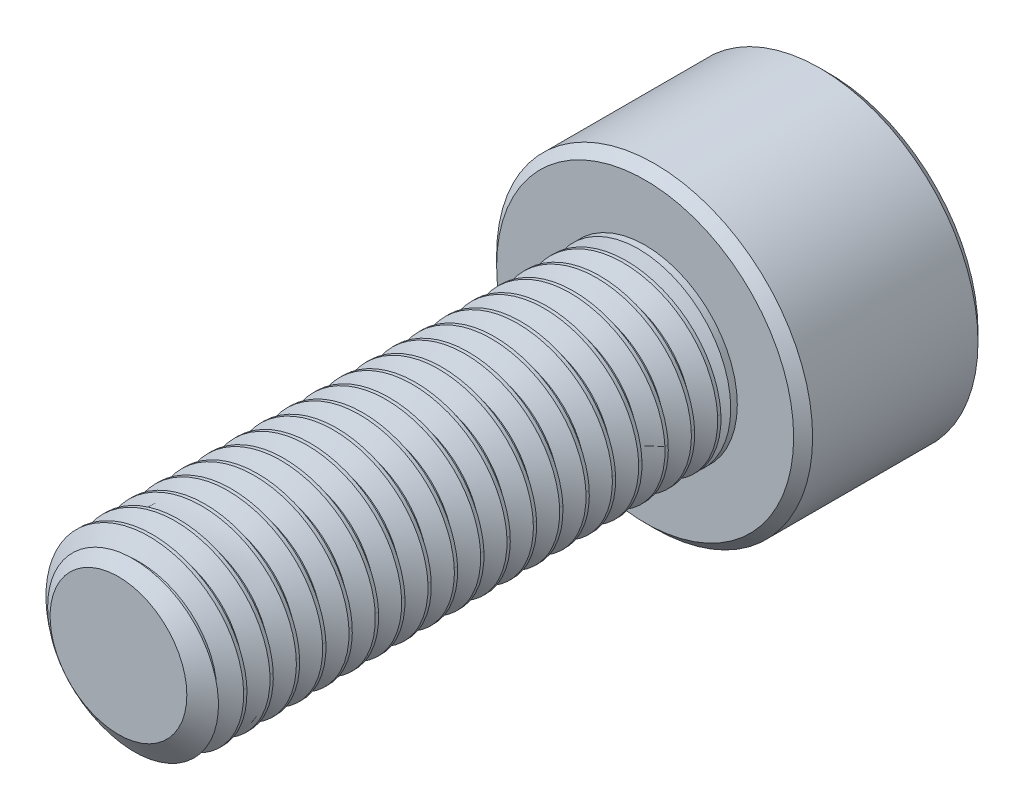
from build123d import *

# Parameters (mm, degrees)
SKETCH1_R          = 3.5
EXTRUDE1_DEPTH     = 20
CUT_SWEEP1_PITCH   = 1
SKETCH6_R          = 6
EXTRUDE2_DEPTH     = 7
CUT_EXTRUDE1_DEPTH = 4.5
CHAMFER1_SIZE      = 0.36


with BuildPart() as part:
    # Sketch1 → Extrude1 (new body)
    with BuildSketch(Plane.XY):
        Circle(SKETCH1_R)
    extrude(amount=-EXTRUDE1_DEPTH)

    # Cut-Sweep1: arcs per turn and ends read off the stored shape
    # Cut-Sweep1: the profile of Sketch3 profile screwed along a right-hand helix through 23 turns, 6 arcs to a turn; built about Z, then put on its axis
    cut_sweep1_z = Axis((0, 0, 0), (0, 0, 1))
    cut_sweep1_corners = [(3.5003, 0, -1.875173205), (2.850480947, 0, -1.5), (2.850480947, 0, -1.375), (3.5003, 0, -0.999826795)]
    with BuildLine(mode=Mode.PRIVATE) as cut_sweep1_profile:
        Line(cut_sweep1_corners[0], cut_sweep1_corners[1])
        Line(cut_sweep1_corners[1], cut_sweep1_corners[2])
        Line(cut_sweep1_corners[2], cut_sweep1_corners[3])
        Line(cut_sweep1_corners[3], cut_sweep1_corners[0])
    cut_sweep1_cap = Face(cut_sweep1_profile.wire())
    cut_sweep1_turn_angles = [0, 30, 60, 90, 120, 150, 180, 210, 240, 270, 300, 330, 360]
    cut_sweep1_turn_weights = [1, 0.8660254037844387, 1, 0.8660254037844387, 1, 0.8660254037844387, 1, 0.8660254037844387, 1, 0.8660254037844387, 1, 0.8660254037844387, 1]
    cut_sweep1_turn_rails = [Edge.make_bspline([Vector(p[0], p[1], 0).rotate(cut_sweep1_z, cut_sweep1_turn_angles[k]) / cut_sweep1_turn_weights[k] + Vector(0, 0, p[2] + CUT_SWEEP1_PITCH * cut_sweep1_turn_angles[k] / 360) for k in range(13)], [0, 0, 0, 1, 1, 2, 2, 3, 3, 4, 4, 5, 5, 6, 6, 6], 2, cut_sweep1_turn_weights) for p in cut_sweep1_corners]
    cut_sweep1_turn_sides = [Face.make_surface_from_curves(cut_sweep1_turn_rails[p[0]], cut_sweep1_turn_rails[p[1]]) for p in [(0, 1), (1, 2), (2, 3), (3, 0)]]
    cut_sweep1 = Plane(origin=(0, 0, 0), x_dir=(0, 1, 0), z_dir=(0, 0, -1)) * Solid(Shell([*[p.moved(Location((0, 0, CUT_SWEEP1_PITCH * i))) for i in range(23) for p in cut_sweep1_turn_sides], cut_sweep1_cap, cut_sweep1_cap.rotate(cut_sweep1_z, 8280).moved(Location((0, 0, CUT_SWEEP1_PITCH * 8280 / 360)))]))
    add(cut_sweep1, mode=Mode.SUBTRACT)

    # Sketch4 → Cut-Revolve1 (revolve, cut)
    with BuildSketch(Plane(origin=(0, 0, 0), x_dir=(0, 0, -1), z_dir=(1, 0, 0)), mode=Mode.PRIVATE) as cut_revolve1_sk:
        Polygon((0.632650852, 3.5), (0, 2.596480947), (0, 3.5), align=None)
    revolve(cut_revolve1_sk.sketch.rotate(Axis((0, 0, 0), (0, 0, -1)), 90), axis=Axis((0, 0, 0), (0, 0, -1)), mode=Mode.SUBTRACT)

    # Sketch6 → Extrude2 (add)
    with BuildSketch(Plane(origin=(0, 0, -20), x_dir=(-1, 0, 0), z_dir=(0, 0, -1))):
        with Locations(Location((0, 0, 0), (0, 0, 180))):
            Circle(SKETCH6_R)
    extrude(amount=EXTRUDE2_DEPTH)

    # Sketch7 → Cut-Extrude1 (cut)
    with BuildSketch(Plane(origin=(0, 0, -27), x_dir=(-1, 0, 0), z_dir=(0, 0, -1))):
        Polygon((0, 3.464101615), (-3, 1.732050808), (-3, -1.732050808), (0, -3.464101615), (3, -1.732050808), (3, 1.732050808), align=None)
    extrude(amount=-CUT_EXTRUDE1_DEPTH, mode=Mode.SUBTRACT)

    # Cut-Extrude2 cone 1 section (through the dimple's axis) → Cut-Extrude2 (revolve, cut)
    with BuildSketch(Plane(origin=(0, 0, -27), x_dir=(0, 1, 0), z_dir=(1, 0, 0))):
        Polygon((0, 0), (3.464101615, 0), (0, 3.464101615), align=None)
    revolve(axis=Axis((0, 0, -27), (0, 0, 1)), mode=Mode.SUBTRACT)

    # Chamfer1
    chamfer1_edges = [part.edges().sort_by_distance(p)[0] for p in [
        (-6, 0, -20),
        (-6, 0, -27),
    ]]
    chamfer(chamfer1_edges, length=CHAMFER1_SIZE)

    # Sketch10 → Revolve1 (revolve)
    with BuildSketch(Plane(origin=(0, 0, 0), x_dir=(0, 0, -1), z_dir=(1, 0, 0)), mode=Mode.PRIVATE) as revolve1_sk:
        Polygon((20, 3.5), (20, 0), (18.300252532, 0), (19.75, 3.5), align=None)
    revolve(revolve1_sk.sketch.rotate(Axis((0, 0, -20), (0, 0, 1)), 270), axis=Axis((0, 0, -20), (0, 0, 1)))


solid = part.part
